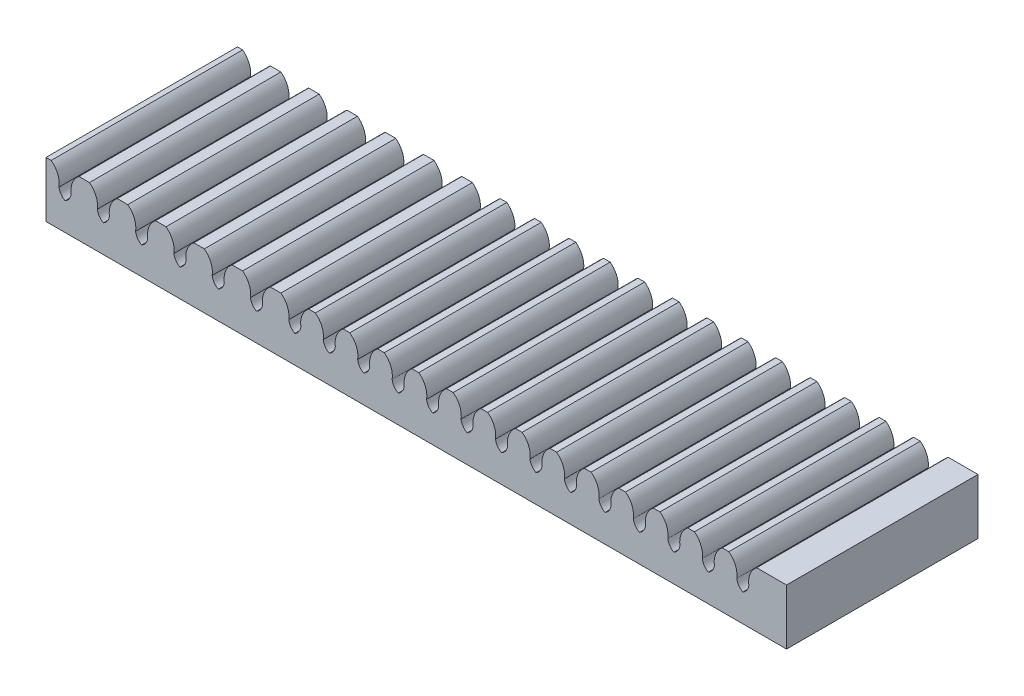
from build123d import *

# Parameters (mm, degrees)
BOSS_EXTRUDE1_DEPTH = 25
CUT_EXTRUDE1_DEPTH  = 26.12
LPATTERN1_COUNT     = 10
LPATTERN1_PITCH     = 5
LPATTERN1_COL_COUNT = 14
LPATTERN1_COL_PITCH = 4.5


with BuildPart() as part:
    # Sketch1 → Boss-Extrude1 (new body)
    with BuildSketch(Plane.XY):
        Polygon((28.000000003, 7), (-39.373173928, 7), (-39.373173928, -0.249149017), (0.939234275, -0.249149017), (57.333339072, -0.249149017), (57.333339072, 7), align=None)
    extrude(amount=BOSS_EXTRUDE1_DEPTH)

    # Sketch2 → Cut-Extrude1 (cut)
    with BuildSketch(Plane.XY):
        with BuildLine():
            ThreePointArc((-6.881285782, 3.348371163), (-7.417069895, 3.826658598), (-7.671285782, 4.498371163))
            ThreePointArc((-7.671285782, 4.498371163), (-7.912320341, 6.04482582), (-8.981285782, 7.188037328))
            ThreePointArc((-8.981285782, 7.188037328), (-6.881285782, 7.762283268), (-4.781285782, 7.188037328))
            ThreePointArc((-4.781285782, 7.188037328), (-5.850251222, 6.04482582), (-6.091285782, 4.498371163))
            ThreePointArc((-6.091285782, 4.498371163), (-6.345501668, 3.826658598), (-6.881285782, 3.348371163))
        make_face()
    cut_extrude1 = extrude(amount=CUT_EXTRUDE1_DEPTH, mode=Mode.SUBTRACT)

    # LPattern1: Cut-Extrude1 ×10
    with Locations(*[(-i * LPATTERN1_PITCH, 0, 0) for i in range(1, LPATTERN1_COUNT)]):
        add(cut_extrude1, mode=Mode.SUBTRACT)

    # LPattern1 col: Cut-Extrude1 ×14
    with Locations(*[(i * LPATTERN1_COL_PITCH, 0, 0) for i in range(1, LPATTERN1_COL_COUNT)]):
        add(cut_extrude1, mode=Mode.SUBTRACT)


solid = part.part
